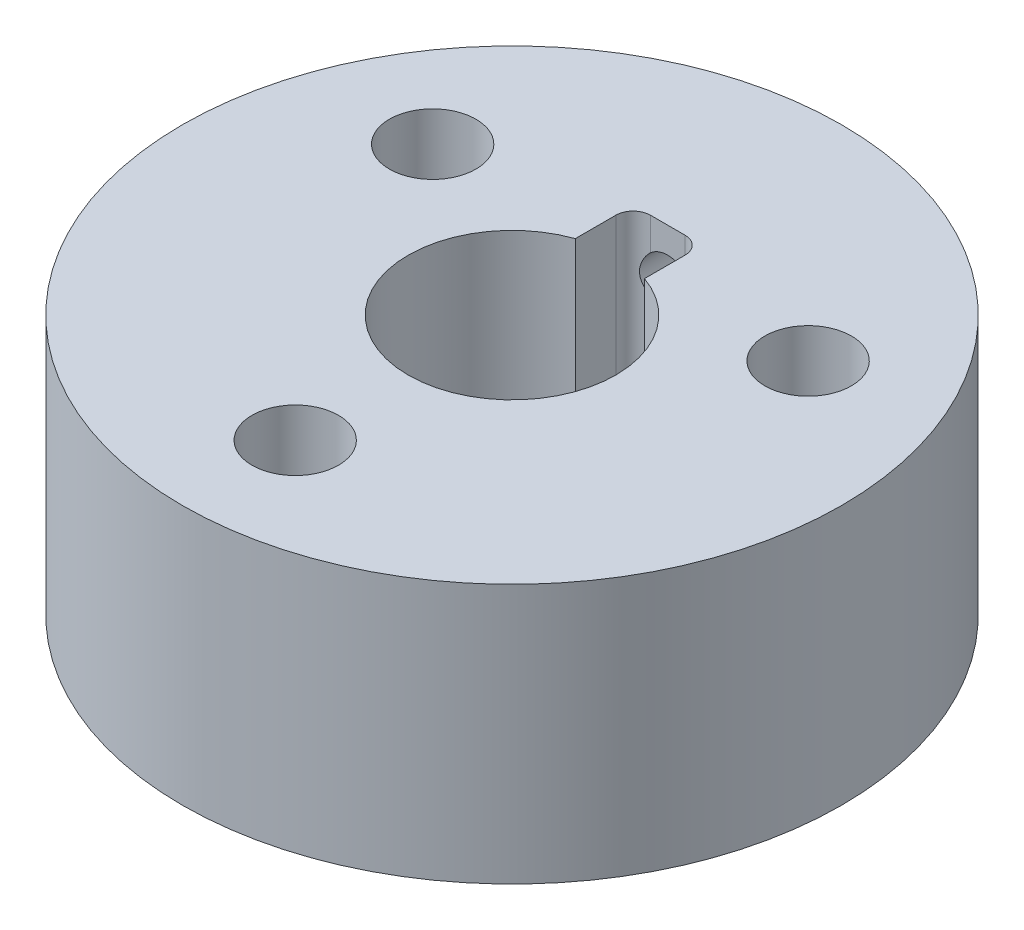
from build123d import *

# Parameters (mm, degrees)
SKETCH1_R               = 19.05
SKETCH1_R_2             = 2.5
BOSS_EXTRUDE1_DEPTH     = 15
CUT_EXTRUDE1_DEPTH      = 3
CUT_EXTRUDE1_DEPTH_BACK = 15
SKETCH2_R               = 1.5
SKETCH4_R               = 1.5
CUT_EXTRUDE2_DEPTH      = 20


with BuildPart() as part:
    # Sketch1 → Boss-Extrude1 (new body)
    with BuildSketch(Plane(origin=(0, 0, 0), x_dir=(1, 0, 0), z_dir=(0, 1, 0))):
        Circle(SKETCH1_R)
        with Locations((0, -12.525)):
            Circle(SKETCH1_R_2, mode=Mode.SUBTRACT)
        with Locations((-10.846968182, 6.2625)):
            Circle(SKETCH1_R_2, mode=Mode.SUBTRACT)
        with BuildLine():
            Line((-2, 5.656854249), (-2, 8))
            ThreePointArc((-2, 8), (-1.707106781, 8.707106781), (-1, 9))
            Line((-1, 9), (1, 9))
            ThreePointArc((1, 9), (1.707106781, 8.707106781), (2, 8))
            Line((2, 8), (2, 5.656854249))
            ThreePointArc((2, 5.656854249), (4.898979486, 3.464101615), (6, 0))
            ThreePointArc((6, 0), (-3.464101615, -4.898979486), (-2, 5.656854249))
        make_face(mode=Mode.SUBTRACT)
        with Locations((10.846968182, 6.2625)):
            Circle(SKETCH1_R_2, mode=Mode.SUBTRACT)
    extrude(amount=BOSS_EXTRUDE1_DEPTH)

    # Sketch2 → Cut-Extrude1 (cut, two sides: drawn at the far end of the back side and taken through both)
    with BuildSketch(Plane.XY.offset(-9).offset(-CUT_EXTRUDE1_DEPTH_BACK)):
        with Locations((0, 12)):
            Circle(SKETCH2_R)
    extrude(amount=CUT_EXTRUDE1_DEPTH + CUT_EXTRUDE1_DEPTH_BACK, mode=Mode.SUBTRACT)

    # Sketch4 → Cut-Extrude2 (cut)
    with BuildSketch(Plane(origin=(0, 0, 0), x_dir=(0, -1, 0), z_dir=(-0.8660254037844398, 0, 0.499999999999998))):
        with Locations((-7, 0)):
            Circle(SKETCH4_R)
    extrude(amount=CUT_EXTRUDE2_DEPTH, mode=Mode.SUBTRACT)


solid = part.part
